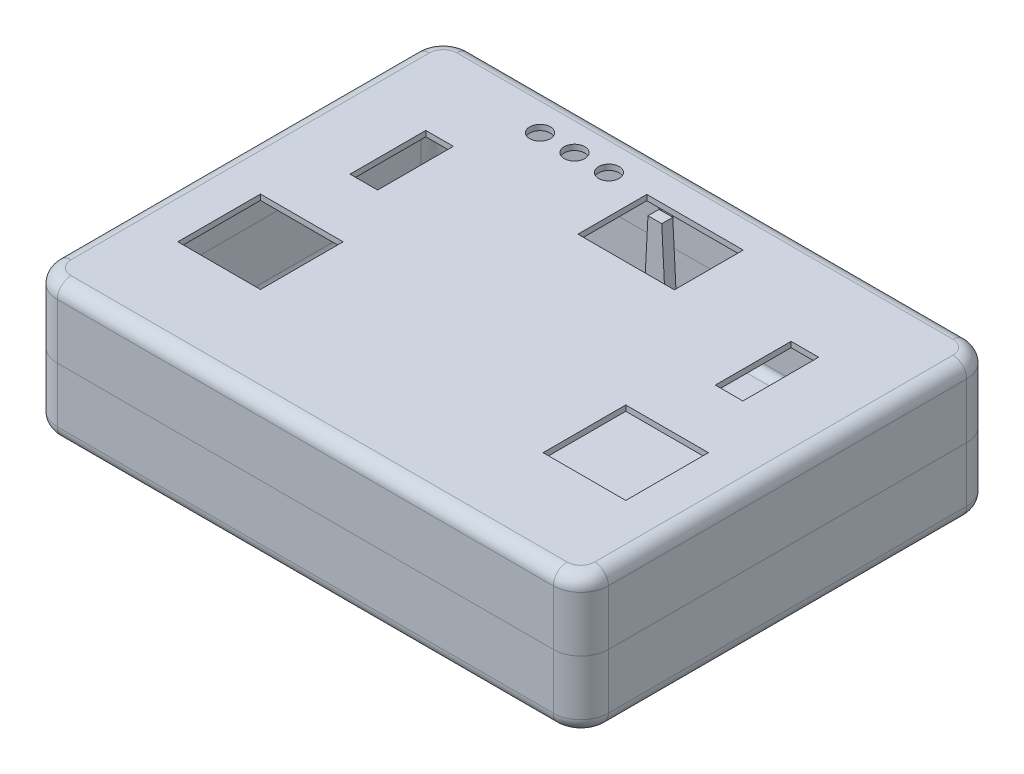
from build123d import *

# Parameters (mm, degrees)
BOSS_EXTRUDE1_DEPTH  = 50
FILLET1_R            = 10
SHELL1_T             = -4
SNAP_START           = -296
SNAP_HOOK1_DEPTH     = 8
SNAP_HOOK1_2_DEPTH   = 8
SNAP_START_2         = -298
SNAP_GROOVE1_DEPTH   = 3
SNAP_START_3         = -297
SNAP_GROOVE1_2_DEPTH = 2
SKETCH6_R            = 7.5
SKETCH6_W            = 70
SKETCH6_H            = 50
CUT_EXTRUDE1_DEPTH   = 4
SKETCH4_W            = 60
SKETCH4_H            = 60
SKETCH4_W_2          = 20
SKETCH4_H_2          = 55
CUT_EXTRUDE2_DEPTH   = 4


with BuildPart() as part:
    # Sketch1 → Boss-Extrude1 (new body)
    with BuildSketch(Plane(origin=(0, 0, 0), x_dir=(1, 0, 0), z_dir=(0, 1, 0))):
        with BuildLine():
            Line((20, 0), (380, 0))
            ThreePointArc((380, 0), (394.142135624, 5.857864376), (400, 20))
            Line((400, 20), (400, 280))
            ThreePointArc((400, 280), (394.142135624, 294.142135624), (380, 300))
            Line((380, 300), (20, 300))
            ThreePointArc((20, 300), (5.857864376, 294.142135624), (0, 280))
            Line((0, 280), (0, 20))
            ThreePointArc((0, 20), (5.857864376, 5.857864376), (20, 0))
        make_face()
    extrude(amount=BOSS_EXTRUDE1_DEPTH)

    # Fillet1
    fillet1_edges = [part.edges().sort_by_distance(p)[0] for p in [
        (200, 0, 0),
        (5.857864376, 0, -5.857864376),
        (0, 0, -150),
        (5.857864376, 0, -294.142135624),
        (200, 0, -300),
        (394.142135624, 0, -294.142135624),
        (400, 0, -150),
        (394.142135624, 0, -5.857864376),
    ]]
    fillet(fillet1_edges, radius=FILLET1_R)

    # Shell1
    shell1_openings = [part.faces().sort_by_distance(p)[0] for p in [
        (200, 50, -150),
    ]]
    offset(amount=SHELL1_T, openings=shell1_openings, kind=Kind.INTERSECTION)


with BuildPart() as body_2:
    # Mirror1: mirrored copy
    add(part.part.mirror(Plane(origin=(20, 50, -280), x_dir=(0, 0, 1), z_dir=(0, -1, 0))))

    # Snap Groove1: read off the stored shape, not the designer's step
    # Snap Groove1 outline → Snap Groove1 (cut)
    with BuildSketch(Plane.XY.offset(SNAP_START_2)):
        Polygon((160.790835622, 71), (160.26675783, 61), (171.105282298, 61), (170.581204505, 71), align=None)
    snap_groove1 = extrude(amount=SNAP_GROOVE1_DEPTH, mode=Mode.SUBTRACT)

    # Snap Groove1 2 outline → Snap Groove1 2 (cut)
    with BuildSketch(Plane.XY.offset(SNAP_START_3)):
        Polygon((171.105282298, 61), (160.266757829, 61), (160.109534492, 58), (171.262505636, 58), align=None)
    snap_groove1_2 = extrude(amount=SNAP_GROOVE1_2_DEPTH, mode=Mode.SUBTRACT)

    # Mirror4: Snap Groove1, Snap Groove1 2 across plane
    add(snap_groove1.mirror(Plane.XY.offset(-150)), mode=Mode.SUBTRACT)
    add(snap_groove1_2.mirror(Plane.XY.offset(-150)), mode=Mode.SUBTRACT)

    # Sketch6 → Cut-Extrude1 (cut)
    with BuildSketch(Plane(origin=(0, 100, 0), x_dir=(1, 0, 0), z_dir=(0, 1, 0))):
        with Locations(Location((150.357112629, 270, 0), (0, 0, 270))):
            Circle(SKETCH6_R)
        with Locations(Location((125.357112629, 270, 0), (0, 0, 270))):
            Circle(SKETCH6_R)
        with Locations(Location((100.357112629, 270, 0), (0, 0, 270))):
            Circle(SKETCH6_R)
        with Locations((212.857112629, 245)):
            Rectangle(SKETCH6_W, SKETCH6_H)
    extrude(amount=-CUT_EXTRUDE1_DEPTH, mode=Mode.SUBTRACT)

    # Sketch4 → Cut-Extrude2 (cut)
    with BuildSketch(Plane(origin=(0, 100, 0), x_dir=(1, 0, 0), z_dir=(0, 1, 0))):
        with Locations((332.566341506, 100)):
            Rectangle(SKETCH4_W, SKETCH4_H)
        with Locations((332.566341506, 202.5)):
            Rectangle(SKETCH4_W_2, SKETCH4_H_2)
        with Locations((67.433658494, 100)):
            Rectangle(SKETCH4_W, SKETCH4_H)
        with Locations((67.433658494, 202.5)):
            Rectangle(SKETCH4_W_2, SKETCH4_H_2)
    extrude(amount=-CUT_EXTRUDE2_DEPTH, mode=Mode.SUBTRACT)


with BuildPart() as part_1:
    add(part.part)

    # Snap Hook1: read off the stored shape, not the designer's step
    # Snap Hook1 outline → Snap Hook1 (add)
    with BuildSketch(Plane.XY.offset(SNAP_START)):
        Polygon((171.105282298, 61), (170.686020064, 69), (160.686020064, 69), (160.26675783, 61), align=None)
    snap_hook1 = extrude(amount=SNAP_HOOK1_DEPTH)

    # Snap Hook1 2 outline → Snap Hook1 2 (add)
    with BuildSketch(Plane.XY.offset(SNAP_START)):
        Polygon((171.105282298, 61), (160.266757829, 61), (157.27951441, 4), (174.092525717, 4), align=None)
    snap_hook1_2 = extrude(amount=SNAP_HOOK1_2_DEPTH)

    # Snap Hook1 3: loft between two sections, ruled curve by curve
    snap_hook1_3_from = [
        Edge.make_line((160.686020064, 69, -296), (170.686020064, 69, -296)),
        Edge.make_line((171.105282298, 61, -296), (160.266757829, 61, -296)),
        Edge.make_line((171.105282298, 61, -296), (170.686020064, 69, -296)),
        Edge.make_line((160.266757829, 61, -296), (160.686020064, 69, -296)),
    ]
    snap_hook1_3_to = [
        Edge.make_line((160.423981167, 64, -298), (170.94805896, 64, -298)),
        Edge.make_line((171.105282298, 61, -298), (160.266757829, 61, -298)),
        Edge.make_line((171.105282298, 61, -298), (170.94805896, 64, -298)),
        Edge.make_line((160.266757829, 61, -298), (160.423981167, 64, -298)),
    ]
    snap_hook1_3 = Solid(Shell([*[Face.make_surface_from_curves(snap_hook1_3_from[k], snap_hook1_3_to[k]) for k in range(4)], Face(Wire(snap_hook1_3_from)), Face(Wire(snap_hook1_3_to))]))
    add(snap_hook1_3)

    # Mirror3: Snap Hook1, Snap Hook1 2, Snap Hook1 3 across plane
    add(snap_hook1.mirror(Plane.XY.offset(-150)))
    add(snap_hook1_2.mirror(Plane.XY.offset(-150)))
    add(snap_hook1_3.mirror(Plane.XY.offset(-150)))


solid = Compound([body_2.part, part_1.part])
